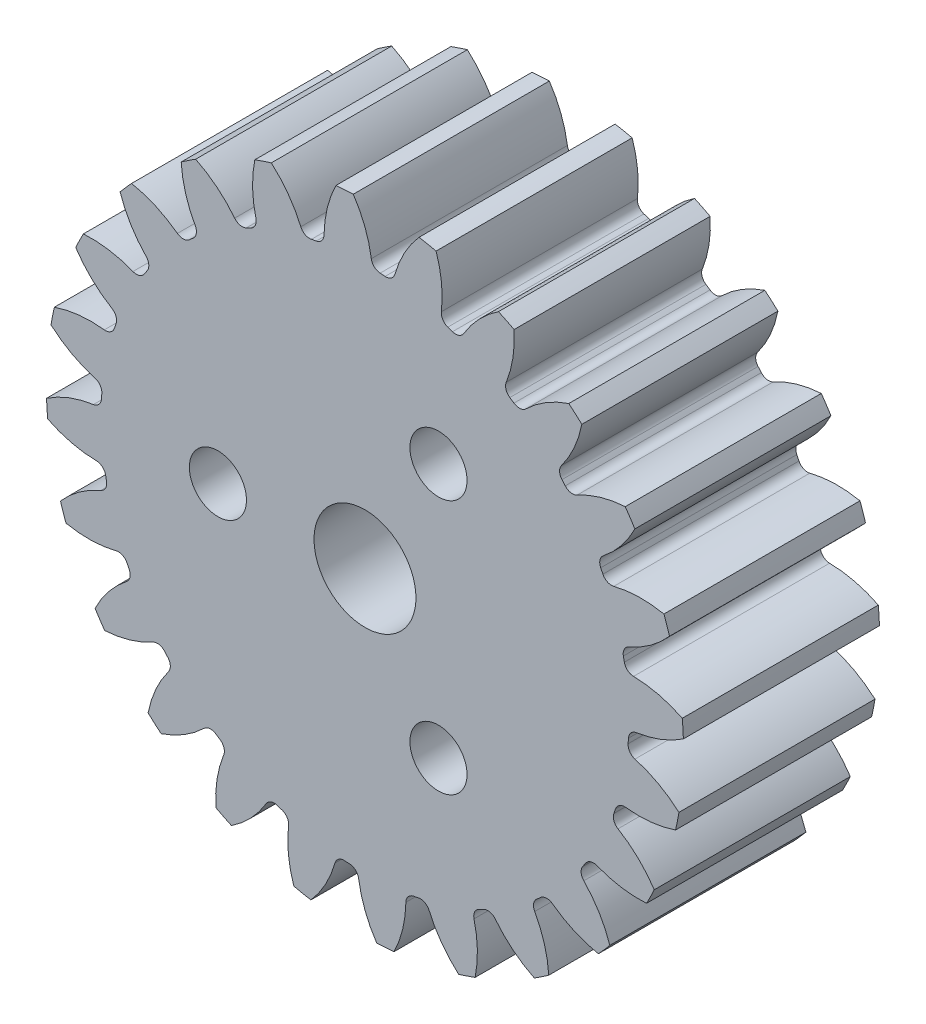
from build123d import *

# Parameters (mm, degrees)
SKETCH3_R          = 20.6375
GEARBODY_DEPTH     = 12.7
TOOTHCUT_DEPTH     = 32.829276029
CIRPATTERN1_COUNT  = 24
SKETCH4_R          = 1.849999983
CUT_EXTRUDE1_DEPTH = 32.811300403
SKETCH5_R          = 3.302
CUT_EXTRUDE2_DEPTH = 32.811300403


with BuildPart() as part:
    # Sketch3 → gearBody (new body)
    with BuildSketch(Plane.XY):
        Circle(SKETCH3_R)
    extrude(amount=GEARBODY_DEPTH)

    # Sketch2 → toothCut (cut, through all)
    with BuildSketch(Plane.XY):
        with BuildLine():
            ThreePointArc((17.04439181, -1.303986765), (17.05590718, -1.14354882), (17.065912391, -0.983009622))
            ThreePointArc((17.065912391, -0.983009622), (17.226475942, -0.603092534), (17.591114308, -0.410332293))
            ThreePointArc((17.591114308, -0.410332293), (20.42378314, 0.626979823), (22.599606758, 2.716434472))
            ThreePointArc((22.599606758, 2.716434472), (22.711286815, -1.522725526), (22.034703624, -5.709034773))
            ThreePointArc((22.034703624, -5.709034773), (20.157284273, -3.347822008), (17.488443939, -1.941649751))
            ThreePointArc((17.488443939, -1.941649751), (17.152801577, -1.701937731), (17.04439181, -1.303986765))
        make_face()
    toothcut = extrude(amount=TOOTHCUT_DEPTH, mode=Mode.SUBTRACT)

    # CirPattern1: toothCut ×24 about axis
    cirpattern1_axis = Axis((0, 0, 12.7), (0, 0, -1))
    for i in range(1, CIRPATTERN1_COUNT):
        add(toothcut.rotate(cirpattern1_axis, i * 360 / CIRPATTERN1_COUNT), mode=Mode.SUBTRACT)

    # Sketch4 → Cut-Extrude1 (cut, through all)
    with BuildSketch(Plane(origin=(0, 0, 0), x_dir=(-1, 0, 0), z_dir=(0, 0, -1))):
        with Locations((9.525, 0)):
            Circle(SKETCH4_R)
        with Locations((-4.7625, -8.248891971)):
            Circle(SKETCH4_R)
        with Locations((-4.7625, 8.248891971)):
            Circle(SKETCH4_R)
    extrude(amount=-CUT_EXTRUDE1_DEPTH, mode=Mode.SUBTRACT)

    # Sketch5 → Cut-Extrude2 (cut, through all)
    with BuildSketch(Plane(origin=(0, 0, 0), x_dir=(-1, 0, 0), z_dir=(0, 0, -1))):
        Circle(SKETCH5_R)
    extrude(amount=-CUT_EXTRUDE2_DEPTH, mode=Mode.SUBTRACT)


solid = part.part
